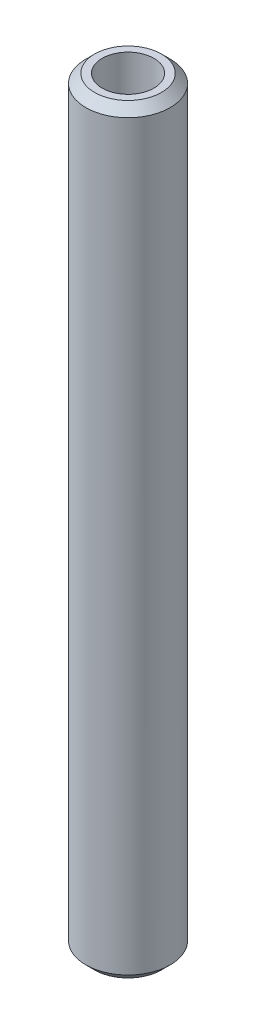
from build123d import *

# Parameters (mm, degrees)
SKETCH1_R           = 27.5
BOSS_EXTRUDE1_DEPTH = 495.990920393
SKETCH2_R           = 16.88939606
CUT_EXTRUDE1_DEPTH  = 498.513309483
CHAMFER1_SIZE       = 5.712192878


with BuildPart() as part:
    # Sketch1 → Boss-Extrude1 (new body)
    with BuildSketch(Plane(origin=(0, 0, 0), x_dir=(1, 0, 0), z_dir=(0, 1, 0))):
        Circle(SKETCH1_R)
    extrude(amount=BOSS_EXTRUDE1_DEPTH)

    # Sketch2 → Cut-Extrude1 (cut, through all)
    with BuildSketch(Plane(origin=(0, 0, 0), x_dir=(1, 0, 0), z_dir=(0, 1, 0))):
        Circle(SKETCH2_R)
    extrude(amount=CUT_EXTRUDE1_DEPTH, mode=Mode.SUBTRACT)

    # Chamfer1
    chamfer1_edges = [part.edges().sort_by_distance(p)[0] for p in [
        (-27.5, 495.990920393, 0),
        (-27.5, 0, 0),
    ]]
    chamfer(chamfer1_edges, length=CHAMFER1_SIZE)


solid = part.part
